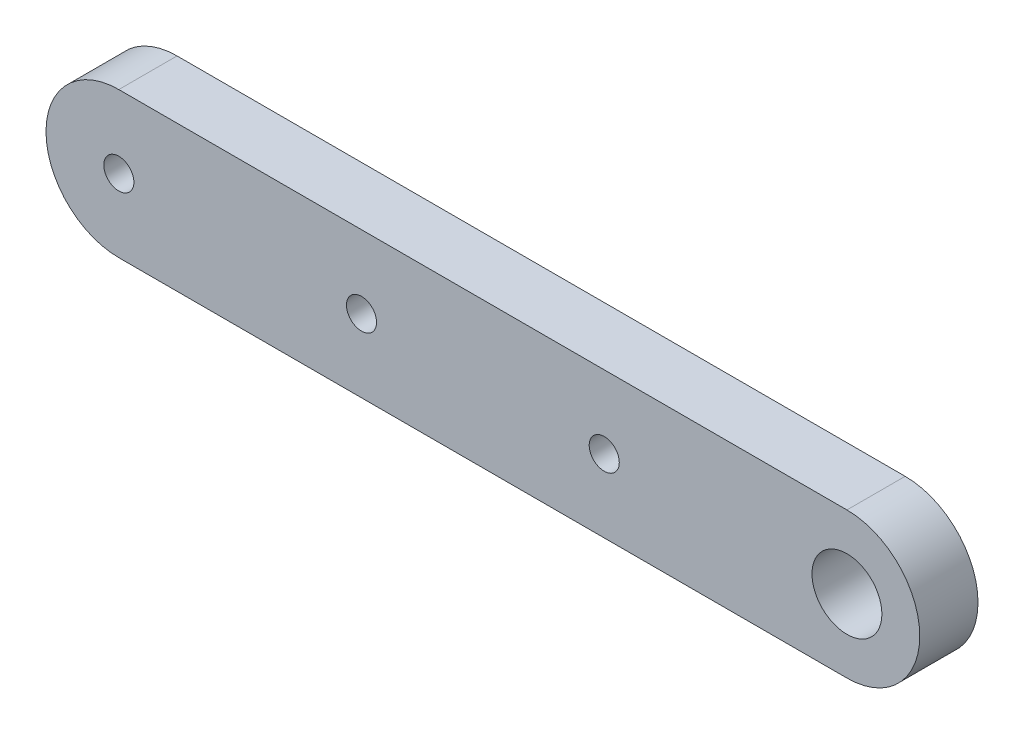
from build123d import *

# Parameters (mm, degrees)
BOSS_EXTRUDE1_DEPTH = 6
SKETCH2_R           = 1.55
CUT_EXTRUDE1_DEPTH  = 84.057209199
LPATTERN1_COUNT     = 4
LPATTERN1_PITCH     = 25
SKETCH3_R           = 3.6
CUT_EXTRUDE2_DEPTH  = 84.057209199


with BuildPart() as part:
    # Sketch1 → Boss-Extrude1 (new body)
    with BuildSketch(Plane.XY):
        with BuildLine():
            Line((75, 7.5), (0, 7.5))
            ThreePointArc((0, 7.5), (-7.5, 0), (0, -7.5))
            Line((0, -7.5), (75, -7.5))
            ThreePointArc((75, -7.5), (82.5, 0), (75, 7.5))
        make_face()
    extrude(amount=BOSS_EXTRUDE1_DEPTH)

    # Sketch2 → Cut-Extrude1 (cut, through all)
    with BuildSketch(Plane.XY.offset(6)):
        Circle(SKETCH2_R)
        with Locations((75, 0)):
            Circle(SKETCH2_R)
    cut_extrude1 = extrude(amount=-CUT_EXTRUDE1_DEPTH, mode=Mode.SUBTRACT)

    # LPattern1: Cut-Extrude1 ×4
    with Locations(*[(i * LPATTERN1_PITCH, 0, 0) for i in range(1, LPATTERN1_COUNT)]):
        add(cut_extrude1, mode=Mode.SUBTRACT)

    # Sketch3 → Cut-Extrude2 (cut, through all)
    with BuildSketch(Plane.XY.offset(6)):
        with Locations((75, 0)):
            Circle(SKETCH3_R)
    extrude(amount=-CUT_EXTRUDE2_DEPTH, mode=Mode.SUBTRACT)


solid = part.part
